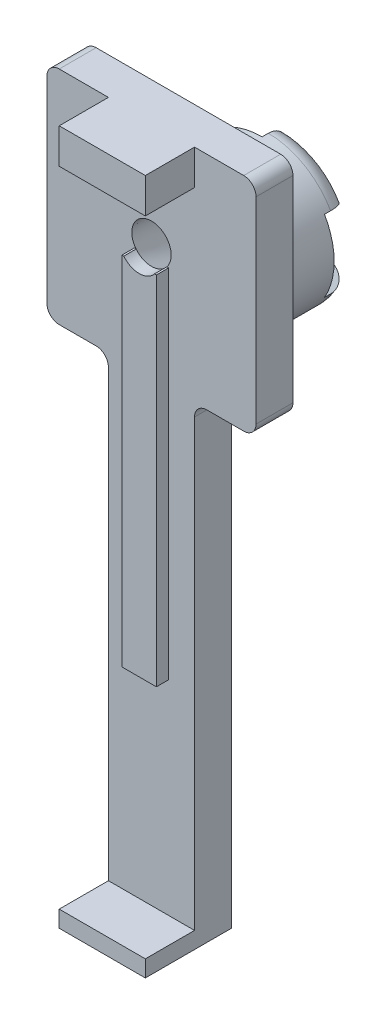
from build123d import *

# Parameters (mm, degrees)
SKETCH1_W           = 7
SKETCH1_H           = 56.5
BOSS_EXTRUDE1_DEPTH = 3
SKETCH2_W           = 2.8
SKETCH2_H           = 29
BOSS_EXTRUDE2_DEPTH = 1
SKETCH3_W           = 7
SKETCH3_H           = 2.85
SKETCH3_H_2         = 1.35
BOSS_EXTRUDE3_DEPTH = 4
SKETCH4_W           = 3
SKETCH4_H           = 18
BOSS_EXTRUDE4_DEPTH = 5
SKETCH5_W           = 3
SKETCH5_H           = 18
BOSS_EXTRUDE5_DEPTH = 5
SKETCH9_R           = 5.85
BOSS_EXTRUDE7_DEPTH = 8
FILLET1_R           = 1.5
FILLET2_R           = 1
SKETCH11_R          = 3.436863838
SKETCH7_R           = 1.6
CUT_EXTRUDE5_START  = -2
CUT_EXTRUDE5_DEPTH  = 2
SKETCH14_R          = 1.6
CUT_EXTRUDE6_DEPTH  = 3


with BuildPart() as part:
    # Sketch1 → Boss-Extrude1 (new body)
    with BuildSketch(Plane.XY):
        with Locations((0, 9.795104227)):
            Rectangle(SKETCH1_W, SKETCH1_H)
    extrude(amount=BOSS_EXTRUDE1_DEPTH)

    # Sketch2 → Boss-Extrude2 (add)
    with BuildSketch(Plane.XY.offset(3)):
        with Locations((0, 13.995104227)):
            Rectangle(SKETCH2_W, SKETCH2_H)
    extrude(amount=BOSS_EXTRUDE2_DEPTH)

    # Sketch3 → Boss-Extrude3 (add)
    with BuildSketch(Plane.XY.offset(3)):
        with Locations((0, 36.620104227)):
            Rectangle(SKETCH3_W, SKETCH3_H)
        with Locations((0, -17.779895773)):
            Rectangle(SKETCH3_W, SKETCH3_H_2)
    extrude(amount=BOSS_EXTRUDE3_DEPTH)

    # Sketch4 → Boss-Extrude4 (add)
    with BuildSketch(Plane.ZY.offset(3.5)):
        with Locations((1.5, 29.045104227)):
            Rectangle(SKETCH4_W, SKETCH4_H)
    extrude(amount=BOSS_EXTRUDE4_DEPTH)

    # Sketch5 → Boss-Extrude5 (add)
    with BuildSketch(Plane(origin=(3.5, 0, 0), x_dir=(0, 0, -1), z_dir=(1, 0, 0))):
        with Locations((-1.5, 29.045104227)):
            Rectangle(SKETCH5_W, SKETCH5_H)
    extrude(amount=BOSS_EXTRUDE5_DEPTH)

    # Sketch9 → Boss-Extrude7 (add)
    with BuildSketch(Plane(origin=(0, 0, 0), x_dir=(-1, 0, 0), z_dir=(0, 0, -1))):
        with Locations(Location((0, 26.670104227, 0), (0, 0, 180))):
            Circle(SKETCH9_R)
    extrude(amount=BOSS_EXTRUDE7_DEPTH)

    # Fillet1
    fillet1_edges = [part.edges().sort_by_distance(p)[0] for p in [
        (-5.85, 26.670104227, -8),
    ]]
    fillet(fillet1_edges, radius=FILLET1_R)

    # Fillet2
    fillet2_edges = [part.edges().sort_by_distance(p)[0] for p in [
        (-3.5, 20.045104227, 1.5),
        (-8.5, 20.045104227, 1.5),
        (-8.5, 38.045104227, 1.5),
        (3.5, 20.045104227, 1.5),
        (8.5, 38.045104227, 1.5),
        (8.5, 20.045104227, 1.5),
    ]]
    fillet(fillet2_edges, radius=FILLET2_R)

    # Sketch11 → Cut-Loft6 section 0
    with BuildSketch(Plane(origin=(0, 0, -8), x_dir=(-1, 0, 0), z_dir=(0, 0, -1))):
        with Locations((0, 26.670104227)):
            Circle(SKETCH11_R)
    # Sketch7 → Cut-Loft6 section 1
    with BuildSketch(Plane.XY.offset(3)):
        with Locations((0, 29.495104227)):
            Circle(SKETCH7_R)
    loft(mode=Mode.SUBTRACT)

    # Sketch10 → Cut-Extrude5 (cut)
    with BuildSketch(Plane(origin=(0, 0, -8), x_dir=(-1, 0, 0), z_dir=(0, 0, -1)).offset(CUT_EXTRUDE5_START)):
        with BuildLine():
            ThreePointArc((5.066248612, 29.595104227), (2.925, 31.736352839), (0, 32.520104227))
            Line((0, 32.520104227), (0, 26.670104227))
            Line((0, 26.670104227), (5.066248612, 29.595104227))
        make_face()
        with BuildLine():
            Line((5.066248612, 23.745104227), (0, 26.670104227))
            Line((0, 26.670104227), (0, 20.820104227))
            ThreePointArc((0, 20.820104227), (2.925, 21.603855615), (5.066248612, 23.745104227))
        make_face()
        with BuildLine():
            Line((-5.066248612, 23.745104227), (0, 26.670104227))
            Line((0, 26.670104227), (-5.066248612, 29.595104227))
            ThreePointArc((-5.066248612, 29.595104227), (-5.85, 26.670104227), (-5.066248612, 23.745104227))
        make_face()
    extrude(amount=CUT_EXTRUDE5_DEPTH, mode=Mode.SUBTRACT)

    # Sketch14 → Cut-Extrude6 (cut)
    with BuildSketch(Plane.XY.offset(3)):
        with Locations((0, 29.495104227)):
            Circle(SKETCH14_R)
    extrude(amount=CUT_EXTRUDE6_DEPTH, mode=Mode.SUBTRACT)


solid = part.part
